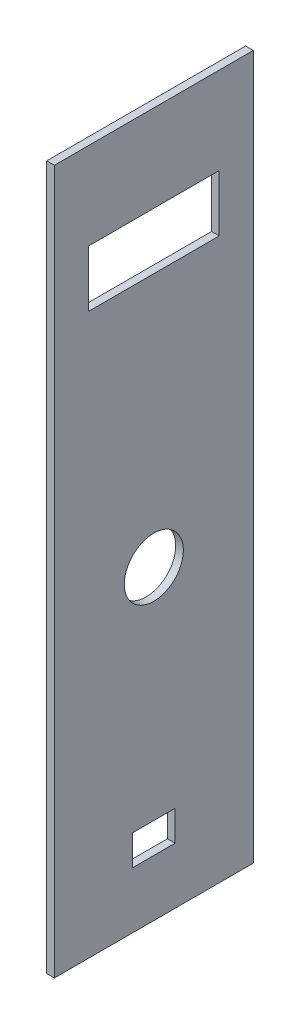
from build123d import *

# Parameters (mm, degrees)
SKETCH1_W           = 82.55
SKETCH1_H           = 292.1
BOSS_EXTRUDE1_DEPTH = 3.175
CUT_EXTRUDE1_REACH  = 305.557
SKETCH2_W           = 50.25
SKETCH2_H           = 19.5
CUT_EXTRUDE2_REACH  = 305.557
SKETCH4_R           = 10.25
CUT_EXTRUDE3_REACH  = 305.557
SKETCH5_W           = 13.7
SKETCH5_H           = 8.55
CUT_EXTRUDE4_REACH  = 305.557
SKETCH6_R           = 12.25
SKETCH6_R_2         = 10.25
SKETCH6_W           = 54.25
SKETCH6_H           = 23.5
SKETCH6_W_2         = 50.25
SKETCH6_H_2         = 19.5
SKETCH6_W_3         = 17.7
SKETCH6_H_3         = 12.55
SKETCH6_W_4         = 13.7
SKETCH6_H_4         = 8.55


with BuildPart() as part:
    # Sketch1 → Boss-Extrude1 (new body)
    with BuildSketch(Plane(origin=(0, 0, 0), x_dir=(0, 0, -1), z_dir=(1, 0, 0))):
        with Locations((41.275, 146.05)):
            Rectangle(SKETCH1_W, SKETCH1_H)
    extrude(amount=BOSS_EXTRUDE1_DEPTH)

    # Sketch2 → Cut-Extrude1 (cut, up to next)
    with BuildSketch(Plane.ZY, mode=Mode.PRIVATE) as cut_extrude1_sk1:
        with Locations((-41.275, 244.25)):
            Rectangle(SKETCH2_W, SKETCH2_H)
    cut_extrude1_tool1 = extrude(cut_extrude1_sk1.sketch, amount=-CUT_EXTRUDE1_REACH, mode=Mode.PRIVATE) & part.part
    add(cut_extrude1_tool1.solids().sort_by_distance((0, 244.25, -41.275))[0], mode=Mode.SUBTRACT)

    # Sketch4 → Cut-Extrude2 (cut, up to next)
    with BuildSketch(Plane.ZY, mode=Mode.PRIVATE) as cut_extrude2_sk1:
        with Locations((-41.275, 127)):
            Circle(SKETCH4_R)
    cut_extrude2_tool1 = extrude(cut_extrude2_sk1.sketch, amount=-CUT_EXTRUDE2_REACH, mode=Mode.PRIVATE) & part.part
    add(cut_extrude2_tool1.solids().sort_by_distance((0, 127, -41.275))[0], mode=Mode.SUBTRACT)

    # Sketch5 → Cut-Extrude3 (cut, up to next)
    with BuildSketch(Plane.ZY, mode=Mode.PRIVATE) as cut_extrude3_sk1:
        with Locations((-41.275, 29.675)):
            Rectangle(SKETCH5_W, SKETCH5_H)
    cut_extrude3_tool1 = extrude(cut_extrude3_sk1.sketch, amount=-CUT_EXTRUDE3_REACH, mode=Mode.PRIVATE) & part.part
    add(cut_extrude3_tool1.solids().sort_by_distance((0, 29.675, -41.275))[0], mode=Mode.SUBTRACT)

    # Sketch6 → Cut-Extrude4 (cut, up to next)
    with BuildSketch(Plane.ZY, mode=Mode.PRIVATE) as cut_extrude4_sk1:
        with Locations((-41.275, 127)):
            Circle(SKETCH6_R)
        with Locations((-41.275, 127)):
            Circle(SKETCH6_R_2, mode=Mode.SUBTRACT)
    cut_extrude4_tool1 = extrude(cut_extrude4_sk1.sketch, amount=-CUT_EXTRUDE4_REACH, mode=Mode.PRIVATE) & part.part
    # Sketch6 → Cut-Extrude4 (cut, up to next)
    with BuildSketch(Plane.ZY, mode=Mode.PRIVATE) as cut_extrude4_sk2:
        with Locations((-41.275, 244.25)):
            Rectangle(SKETCH6_W, SKETCH6_H)
        with Locations((-41.275, 244.25)):
            Rectangle(SKETCH6_W_2, SKETCH6_H_2, mode=Mode.SUBTRACT)
    cut_extrude4_tool2 = extrude(cut_extrude4_sk2.sketch, amount=-CUT_EXTRUDE4_REACH, mode=Mode.PRIVATE) & part.part
    # Sketch6 → Cut-Extrude4 (cut, up to next)
    with BuildSketch(Plane.ZY, mode=Mode.PRIVATE) as cut_extrude4_sk3:
        with Locations((-41.275, 29.675)):
            Rectangle(SKETCH6_W_3, SKETCH6_H_3)
        with Locations((-41.275, 29.675)):
            Rectangle(SKETCH6_W_4, SKETCH6_H_4, mode=Mode.SUBTRACT)
    cut_extrude4_tool3 = extrude(cut_extrude4_sk3.sketch, amount=-CUT_EXTRUDE4_REACH, mode=Mode.PRIVATE) & part.part
    add(cut_extrude4_tool1.solids().sort_by_distance((0, 127, -53.178518))[0], mode=Mode.SUBTRACT)
    add(cut_extrude4_tool2.solids().sort_by_distance((0, 255.408788, -41.275))[0], mode=Mode.SUBTRACT)
    add(cut_extrude4_tool3.solids().sort_by_distance((0, 35.733022, -41.275))[0], mode=Mode.SUBTRACT)


solid = part.part
